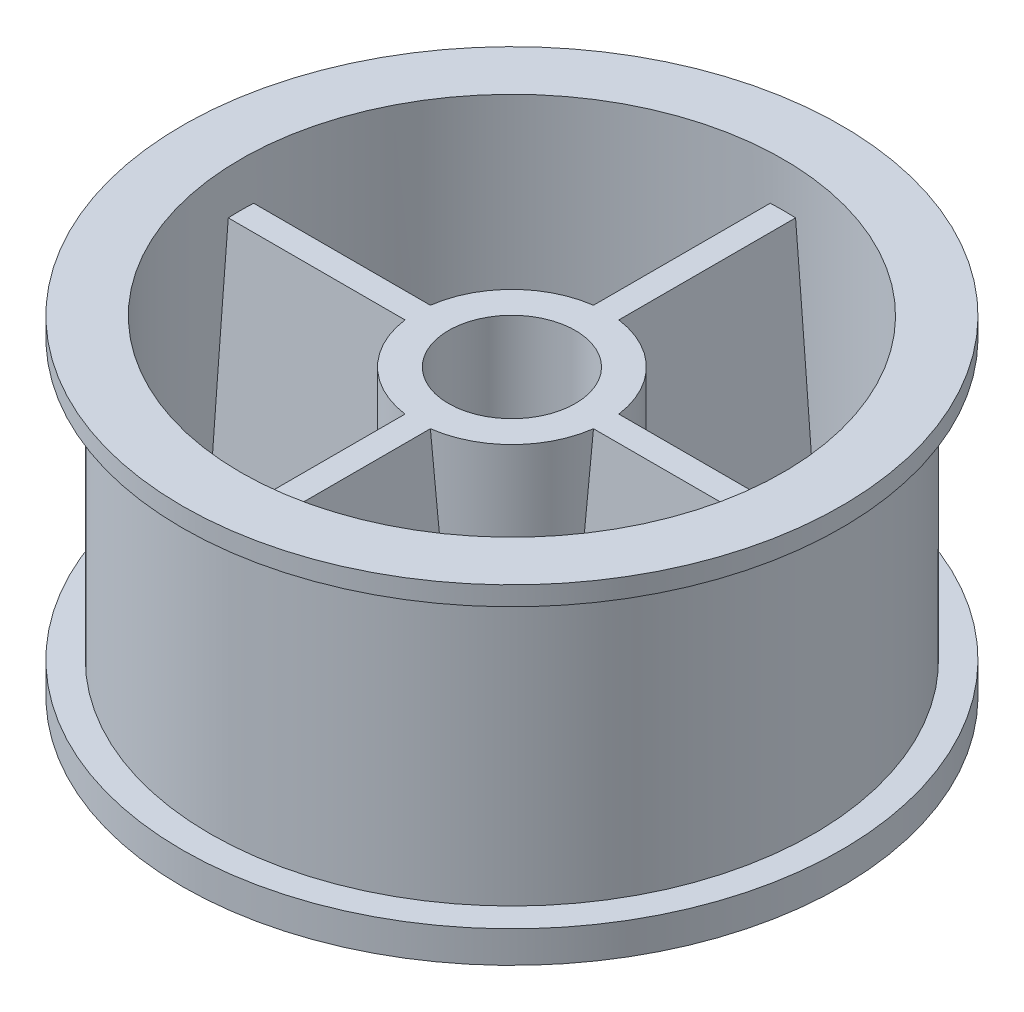
from build123d import *

# Parameters (mm, degrees)
SKETCH3_R           = 7.5
BOSS_EXTRUDE1_DEPTH = 20
SKETCH4_R           = 5
CUT_EXTRUDE1_DEPTH  = 10
SKETCH5_R           = 4.25
CUT_EXTRUDE2_DEPTH  = 40.169503443
RIB1_REACH          = 45.107
SKETCH8_WALLS_W     = 2
SKETCH8_WALLS_H     = 97.69037842
SKETCH8_WALLS_H_2   = 95.268853956
SKETCH8_WALLS_W_2   = 98.322080453
SKETCH8_WALLS_H_3   = 2
SKETCH8_WALLS_W_3   = 97.479811074
RIB1_DRAFT_ANGLE    = 5


with BuildPart() as part:
    # Sketch2 → Revolve1 (revolve)
    with BuildSketch(Plane(origin=(0, 0, 0), x_dir=(0, 0, -1), z_dir=(1, 0, 0))):
        Polygon((0, 0), (26, 0), (26, 2.5), (23.8, 2.5), (23.8, 23.229829408), (26, 24.5), (26, 26), (21.4, 26), (21.4, 2.5), (0, 2.5), align=None)
    revolve(axis=Axis((0, 2.5, 0), (0, -1, 0)))

    # Sketch3 → Boss-Extrude1 (add)
    with BuildSketch(Plane(origin=(0, 2.5, 0), x_dir=(1, 0, 0), z_dir=(0, 1, 0))):
        Circle(SKETCH3_R)
    extrude(amount=BOSS_EXTRUDE1_DEPTH)

    # Sketch4 → Cut-Extrude1 (cut)
    with BuildSketch(Plane(origin=(0, 22.5, 0), x_dir=(1, 0, 0), z_dir=(0, 1, 0))):
        Circle(SKETCH4_R)
    extrude(amount=-CUT_EXTRUDE1_DEPTH, mode=Mode.SUBTRACT)

    # Sketch5 → Cut-Extrude2 (cut, through all)
    with BuildSketch(Plane(origin=(0, 12.5, 0), x_dir=(1, 0, 0), z_dir=(0, 1, 0))):
        Circle(SKETCH5_R)
    extrude(amount=-CUT_EXTRUDE2_DEPTH, mode=Mode.SUBTRACT)

    # Sketch8 walls → Rib1 (add, up to next)
    with BuildSketch(Plane(origin=(0, 22.5, 0), x_dir=(1, 0, 0), z_dir=(0, 1, 0)), mode=Mode.PRIVATE) as rib1_sk1:
        with Locations((0, 14.476504946)):
            Rectangle(SKETCH8_WALLS_W, SKETCH8_WALLS_H)
    rib1_tool1 = extrude(rib1_sk1.sketch, amount=-RIB1_REACH, mode=Mode.PRIVATE) - part.part
    # Sketch8 walls → Rib1 (add, up to next)
    with BuildSketch(Plane(origin=(0, 22.5, 0), x_dir=(1, 0, 0), z_dir=(0, 1, 0)), mode=Mode.PRIVATE) as rib1_sk2:
        with Locations((0, -14.529146782)):
            Rectangle(SKETCH8_WALLS_W, SKETCH8_WALLS_H_2)
    rib1_tool2 = extrude(rib1_sk2.sketch, amount=-RIB1_REACH, mode=Mode.PRIVATE) - part.part
    # Sketch8 walls → Rib1 (add, up to next)
    with BuildSketch(Plane(origin=(0, 22.5, 0), x_dir=(1, 0, 0), z_dir=(0, 1, 0)), mode=Mode.PRIVATE) as rib1_sk3:
        with Locations((14.318579438, 0)):
            Rectangle(SKETCH8_WALLS_W_2, SKETCH8_WALLS_H_3)
    rib1_tool3 = extrude(rib1_sk3.sketch, amount=-RIB1_REACH, mode=Mode.PRIVATE) - part.part
    # Sketch8 walls → Rib1 (add, up to next)
    with BuildSketch(Plane(origin=(0, 22.5, 0), x_dir=(1, 0, 0), z_dir=(0, 1, 0)), mode=Mode.PRIVATE) as rib1_sk4:
        with Locations((-13.792161076, 0)):
            Rectangle(SKETCH8_WALLS_W_3, SKETCH8_WALLS_H_3)
    rib1_tool4 = extrude(rib1_sk4.sketch, amount=-RIB1_REACH, mode=Mode.PRIVATE) - part.part
    add(rib1_tool1.solids().sort_by_distance((0, 22.5, -14.476504946))[0])
    add(rib1_tool2.solids().sort_by_distance((0, 22.5, 14.529146782))[0])
    add(rib1_tool3.solids().sort_by_distance((14.318579437, 22.5, 0))[0])
    add(rib1_tool4.solids().sort_by_distance((-13.792161076, 22.5, 0))[0])

    # Rib1 draft
    rib1_draft_faces = [part.faces().sort_by_distance(p)[0] for p in [
        (1, 22, -14.476504946),
        (-1, 22, -14.476504946),
        (-1, 22, 14.529146782),
        (1, 22, 14.529146782),
        (14.318579437, 22, 1),
        (14.318579437, 22, -1),
        (-13.792161076, 22, -1),
        (-13.792161076, 22, 1),
    ]]
    draft(rib1_draft_faces, Plane(origin=(0, 22.5, -14.476504946), x_dir=(1, 0, 0), z_dir=(0, 1, 0)), RIB1_DRAFT_ANGLE)


solid = part.part
